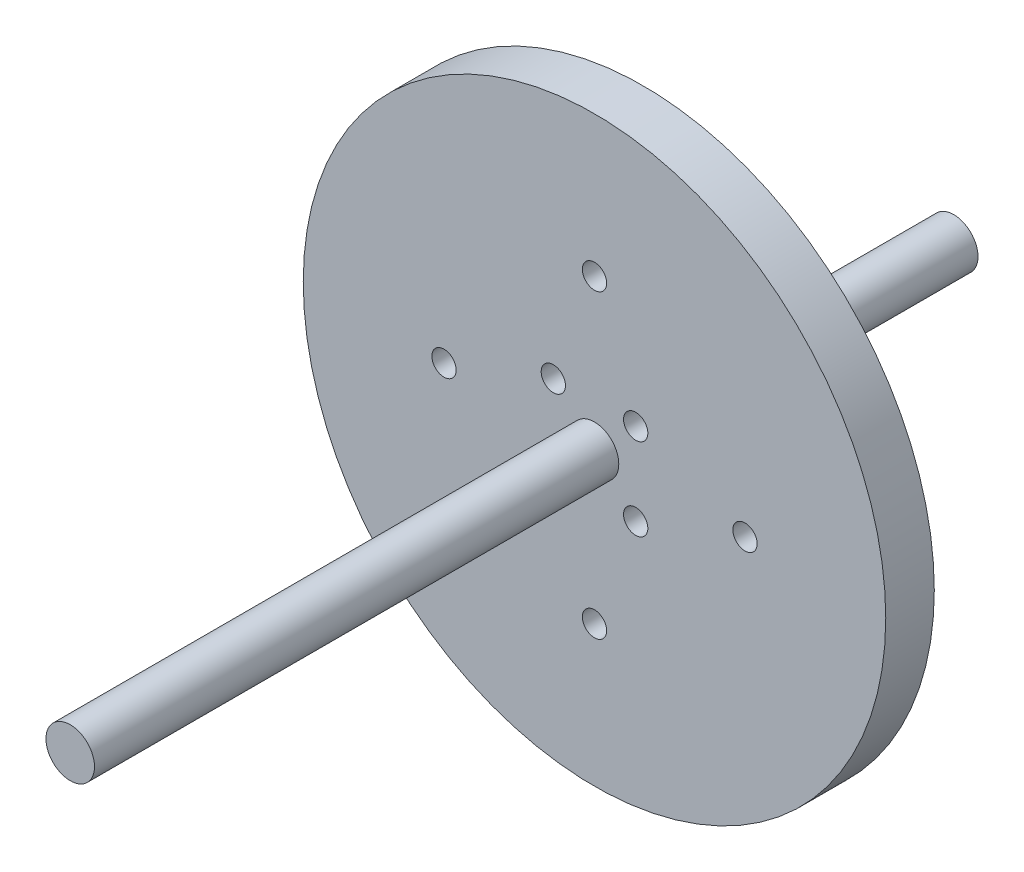
from build123d import *

# Parameters (mm, degrees)
SKETCH1_R           = 30
BOSS_EXTRUDE1_DEPTH = 5
SKETCH2_R           = 1.25
CUT_EXTRUDE1_DEPTH  = 5
SKETCH3_R           = 2.5
BOSS_EXTRUDE2_DEPTH = 32
BOSS_EXTRUDE3_START = 54
SKETCH4_R           = 2.5
BOSS_EXTRUDE3_DEPTH = 54


with BuildPart() as part:
    # Sketch1 → Boss-Extrude1 (new body)
    with BuildSketch(Plane.XY):
        Circle(SKETCH1_R)
    extrude(amount=BOSS_EXTRUDE1_DEPTH)

    # Sketch2 → Cut-Extrude1 (cut)
    with BuildSketch(Plane.XY.offset(5)):
        with Locations((0, 15.5)):
            Circle(SKETCH2_R)
        with Locations((15.5, 0)):
            Circle(SKETCH2_R)
        with Locations((0, -15.5)):
            Circle(SKETCH2_R)
        with Locations((-15.5, 0)):
            Circle(SKETCH2_R)
        with Locations((4.242640687, 4.242640687)):
            Circle(SKETCH2_R)
        with Locations((4.242640687, -4.242640687)):
            Circle(SKETCH2_R)
        with Locations((-4.242640687, -4.242640687)):
            Circle(SKETCH2_R)
        with Locations((-4.242640687, 4.242640687)):
            Circle(SKETCH2_R)
    extrude(amount=-CUT_EXTRUDE1_DEPTH, mode=Mode.SUBTRACT)

    # Sketch3 → Boss-Extrude2 (add)
    with BuildSketch(Plane(origin=(0, 0, 0), x_dir=(-1, 0, 0), z_dir=(0, 0, -1))):
        Circle(SKETCH3_R)
    extrude(amount=BOSS_EXTRUDE2_DEPTH)

    # Sketch4 → Boss-Extrude3 (add)
    with BuildSketch(Plane.XY.offset(5).offset(BOSS_EXTRUDE3_START)):
        Circle(SKETCH4_R)
    extrude(amount=-BOSS_EXTRUDE3_DEPTH)


solid = part.part
